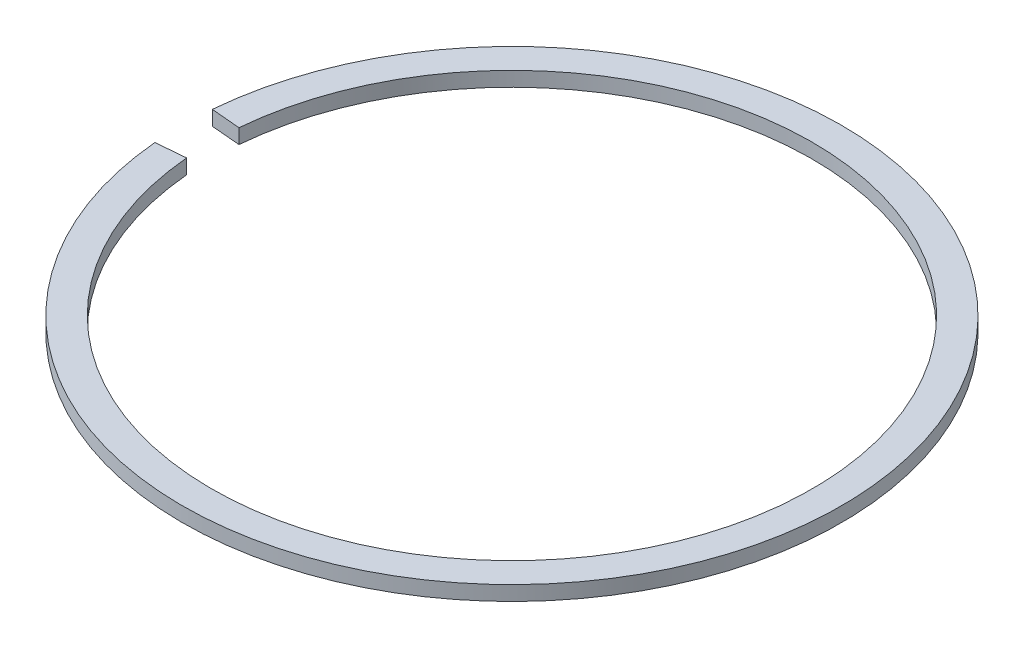
from build123d import *
from build123d.topology import SkipClean

# Parameters (mm, degrees)
SKETCH1_W      = 4
SKETCH1_H      = 2
REVOLVE1_ANGLE = 350


with BuildPart() as part:
    # Sketch1 → Revolve1 (revolve, symmetric)
    with SkipClean():  # the faces are left unmerged after this step: merging them gives an invalid solid
        with BuildSketch(Plane.XY) as revolve1_sk:
            with Locations((43, 1.453608247)):
                Rectangle(SKETCH1_W, SKETCH1_H)
        revolve(axis=Axis((0, 0, 0), (0, 1, 0)), revolution_arc=REVOLVE1_ANGLE / 2)
        revolve(revolve1_sk.sketch, axis=Axis((0, 0, 0), (0, -1, 0)), revolution_arc=REVOLVE1_ANGLE / 2)
    add(part.part.scale(1), mode=Mode.REPLACE)  # the faces are merged on a copy


solid = part.part
